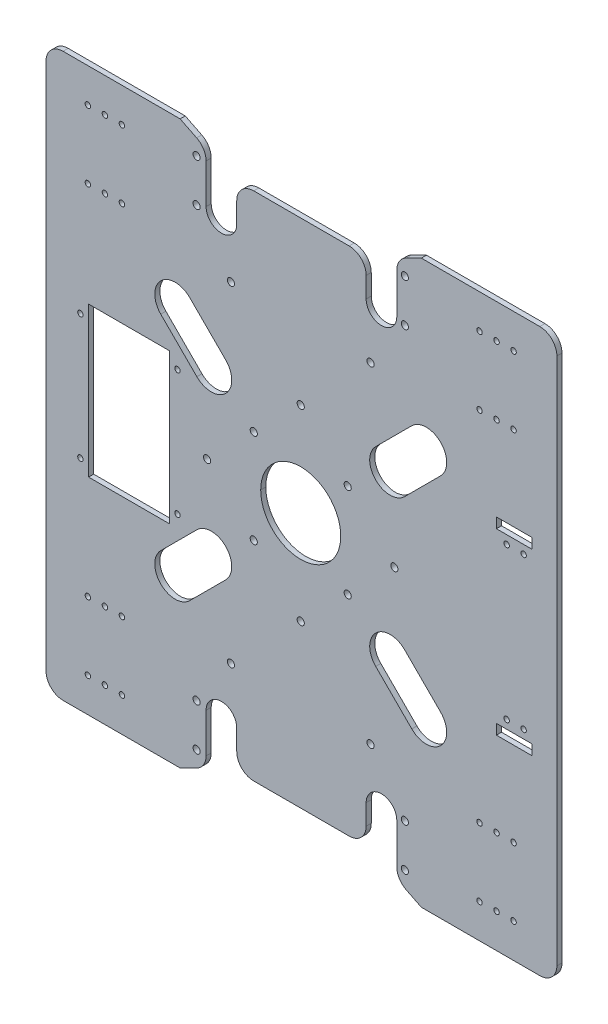
from build123d import *

# Parameters (mm, degrees)
SKETCH_1_R           = 2.100000001
SKETCH_1_R_2         = 2.1
EXTRUDE_1_DEPTH      = 3
CUT_EXTRUDE_1_DEPTH  = 3
SKETCH_8_R           = 2.1
CUT_EXTRUDE_4_DEPTH  = 10
CUT_EXTRUDE_6_DEPTH  = 73
SKETCH_11_R          = 2.1
CUT_EXTRUDE_7_DEPTH  = 73
SKETCH_12_R          = 1.6
CUT_EXTRUDE_8_DEPTH  = 494.526807752
SKETCH_15_W          = 21
SKETCH_15_H          = 6
CUT_EXTRUDE_11_DEPTH = 494.526807752
EXTRUDE_START        = -3
SKETCH_16_R          = 2.1
EXTRUDE_2_DEPTH      = 3
SKETCH_17_R          = 1.6
CUT_EXTRUDE_12_DEPTH = 10
SKETCH_18_W          = 47.4
SKETCH_18_H          = 88
CUT_EXTRUDE_13_DEPTH = 10
SKETCH_19_R          = 1.6
CUT_EXTRUDE_14_DEPTH = 10
CUT_EXTRUDE_START    = -3
SKETCH_20_R          = 1.6
CUT_EXTRUDE_15_DEPTH = 3
CUT_EXTRUDE_START_2  = -10
SKETCH_21_R          = 1.6
CUT_EXTRUDE_16_DEPTH = 10
FILLET_1_R           = 10
FILLET_2_R           = 10
FILLET_3_R           = 10
FILLET_4_R           = 10
FILLET_START         = -1
FILLET_5_DEPTH       = 5
FILLET_6_R           = 10


with BuildPart() as part:
    # 草图1 → 凸台-拉伸1 (new body)
    with BuildSketch(Plane.XY):
        with BuildLine():
            Line((439.415186233, 59.591100047), (407.692037148, 59.591100047))
            Line((407.692037148, 59.591100047), (360.292037148, 59.591100047))
            Line((360.292037148, 59.591100047), (312.491923445, 59.591100047))
            ThreePointArc((312.491923445, 59.591100047), (288.992037148, 83.16420293), (265.492150851, 59.591100047))
            Line((265.492150851, 59.591100047), (139.415186233, 59.591100047))
            Line((139.415186233, 59.591100047), (139.415186233, 101.66420293))
            Line((139.415186233, 101.66420293), (139.415186233, 128.16420293))
            Line((139.415186233, 128.16420293), (139.415186233, 214.66420293))
            ThreePointArc((139.415186233, 214.66420293), (142.344118421, 221.735270742), (149.415186233, 224.66420293))
            Line((149.415186233, 224.66420293), (227.415186233, 224.66420293))
            ThreePointArc((227.415186233, 224.66420293), (231.65782692, 222.906843617), (233.415186233, 218.66420293))
            Line((233.415186233, 218.66420293), (233.415186233, 189.66420293))
            Line((233.415186233, 189.66420293), (233.415186233, 187.66420293))
            ThreePointArc((233.415186233, 187.66420293), (242.415186233, 178.66420293), (251.415186233, 187.66420293))
            Line((251.415186233, 187.66420293), (251.415186233, 189.66420293))
            Line((251.415186233, 189.66420293), (251.415186233, 199.66420293))
            ThreePointArc((251.415186233, 199.66420293), (254.344118421, 206.735270742), (261.415186233, 209.66420293))
            Line((261.415186233, 209.66420293), (317.415186233, 209.66420293))
            ThreePointArc((317.415186233, 209.66420293), (324.486254044, 206.735270742), (327.415186233, 199.66420293))
            Line((327.415186233, 199.66420293), (327.415186233, 189.66420293))
            Line((327.415186233, 189.66420293), (327.415186233, 187.66420293))
            ThreePointArc((327.415186233, 187.66420293), (336.415186233, 178.66420293), (345.415186233, 187.66420293))
            Line((345.415186233, 187.66420293), (345.415186233, 189.66420293))
            Line((345.415186233, 189.66420293), (345.415186233, 218.66420293))
            ThreePointArc((345.415186233, 218.66420293), (347.172545545, 222.906843617), (351.415186233, 224.66420293))
            Line((351.415186233, 224.66420293), (429.415186233, 224.66420293))
            ThreePointArc((429.415186233, 224.66420293), (436.486254044, 221.735270742), (439.415186233, 214.66420293))
            Line((439.415186233, 214.66420293), (439.415186233, 115.961294267))
            Line((439.415186233, 115.961294267), (439.415186233, 108.66420293))
            Line((439.415186233, 108.66420293), (439.415186233, 59.591100047))
        make_face()
        with Locations((329.992037148, 156.591100047)):
            Circle(SKETCH_1_R, mode=Mode.SUBTRACT)
        with Locations(Location((247.992037148, 156.591100047, 0), (0, 0, 180))):
            Circle(SKETCH_1_R, mode=Mode.SUBTRACT)
        with Locations((409.415186233, 104.591100047)):
            Circle(SKETCH_1_R_2, mode=Mode.SUBTRACT)
        with Locations((419.415186233, 104.591100047)):
            Circle(SKETCH_1_R_2, mode=Mode.SUBTRACT)
    extrude_1 = extrude(amount=EXTRUDE_1_DEPTH)

    # 草图2 → 切除-拉伸1 (cut)
    with BuildSketch(Plane.XY.offset(3)):
        Polygon((345.415186233, 217.51420293), (338.317591395, 217.51420293), (359.815186233, 234.932605723), (359.815186233, 224.66420293), align=None)
        Polygon((232.568888064, 217.51420293), (218.168888064, 224.66420293), (218.168888064, 234.932605723), (239.666482901, 217.51420293), align=None)
    cut_extrude_1 = extrude(amount=-CUT_EXTRUDE_1_DEPTH, mode=Mode.SUBTRACT)

    # 镜向2: 凸台-拉伸1, 切除-拉伸1 across plane
    add(extrude_1.mirror(Plane(origin=(265.492150851, 59.591100047, 3), x_dir=(0, 0, 1), z_dir=(0, 1, 0))))
    add(cut_extrude_1.mirror(Plane(origin=(265.492150851, 59.591100047, 3), x_dir=(0, 0, 1), z_dir=(0, 1, 0))), mode=Mode.SUBTRACT)

    # 草图8 → 切除-拉伸4 (cut)
    with BuildSketch(Plane(origin=(0, 0, 0), x_dir=(-1, 0, 0), z_dir=(0, 0, -1))):
        with Locations((-343.992037148, 59.517997165)):
            Circle(SKETCH_8_R)
        with Locations((-316.569201614, 31.940832699)):
            Circle(SKETCH_8_R)
        with Locations((-288.992037148, 4.517997165)):
            Circle(SKETCH_8_R)
        with Locations((-261.414872682, 31.940832699)):
            Circle(SKETCH_8_R)
        with Locations((-233.992037148, 59.517997165)):
            Circle(SKETCH_8_R)
        with Locations((-316.569201614, 87.095161631)):
            Circle(SKETCH_8_R)
        with Locations((-288.992037148, 114.517997165)):
            Circle(SKETCH_8_R)
        with Locations((-261.414872682, 87.095161631)):
            Circle(SKETCH_8_R)
    extrude(amount=-CUT_EXTRUDE_4_DEPTH, mode=Mode.SUBTRACT)

    # 草图10 → 切除-拉伸6 (cut)
    with BuildSketch(Plane(origin=(0, 0, 0), x_dir=(-1, 0, 0), z_dir=(0, 0, -1))):
        with BuildLine():
            Line((-349.991019613, 20.590082512), (-371.188399044, -0.607296919))
            ThreePointArc((-371.188399044, -0.607296919), (-371.188399044, -17.577859668), (-354.217836295, -17.577859668))
            Line((-354.217836295, -17.577859668), (-333.020456864, 3.619519763))
            ThreePointArc((-333.020456864, 3.619519763), (-333.020456864, 20.590082512), (-349.991019613, 20.590082512))
        make_face()
        with BuildLine():
            Line((-333.020456864, 115.416474566), (-354.217836295, 136.613853997))
            ThreePointArc((-354.217836295, 136.613853997), (-371.188399044, 136.613853997), (-371.188399044, 119.643291249))
            Line((-371.188399044, 119.643291249), (-349.991019613, 98.445911818))
            ThreePointArc((-349.991019613, 98.445911818), (-333.020456864, 98.445911818), (-333.020456864, 115.416474566))
        make_face()
        with BuildLine():
            Line((-227.993054684, 98.445911818), (-206.795675252, 119.643291249))
            ThreePointArc((-206.795675252, 119.643291249), (-206.795675252, 136.613853997), (-223.766238001, 136.613853997))
            Line((-223.766238001, 136.613853997), (-244.963617432, 115.416474566))
            ThreePointArc((-244.963617432, 115.416474566), (-244.963617432, 98.445911818), (-227.993054684, 98.445911818))
        make_face()
        with BuildLine():
            Line((-244.963617432, 3.619519763), (-223.766238001, -17.577859668))
            ThreePointArc((-223.766238001, -17.577859668), (-206.795675252, -17.577859668), (-206.795675252, -0.607296919))
            Line((-206.795675252, -0.607296919), (-227.993054684, 20.590082512))
            ThreePointArc((-227.993054684, 20.590082512), (-244.963617432, 20.590082512), (-244.963617432, 3.619519763))
        make_face()
    extrude(amount=-CUT_EXTRUDE_6_DEPTH, mode=Mode.SUBTRACT)

    # 草图11 → 切除-拉伸7 (cut)
    with BuildSketch(Plane(origin=(0, 0, 0), x_dir=(-1, 0, 0), z_dir=(0, 0, -1))):
        with Locations((-227.845186233, 185.66420293)):
            Circle(SKETCH_11_R)
        with Locations((-227.845186233, 210.66420293)):
            Circle(SKETCH_11_R)
        with Locations((-227.845186233, -91.33579707)):
            Circle(SKETCH_11_R)
        with Locations((-227.845186233, -66.33579707)):
            Circle(SKETCH_11_R)
        with Locations((-350.138888064, -66.33579707)):
            Circle(SKETCH_11_R)
        with Locations((-350.138888064, -91.33579707)):
            Circle(SKETCH_11_R)
        with Locations((-350.138888064, 210.66420293)):
            Circle(SKETCH_11_R)
        with Locations((-350.138888064, 185.66420293)):
            Circle(SKETCH_11_R)
    extrude(amount=-CUT_EXTRUDE_7_DEPTH, mode=Mode.SUBTRACT)

    # 草图12 → 切除-拉伸8 (cut, through all)
    with BuildSketch(Plane(origin=(0, 0, 0), x_dir=(-1, 0, 0), z_dir=(0, 0, -1))):
        with Locations((-413.995186233, 204.591100047)):
            Circle(SKETCH_12_R)
        with Locations((-406.596402043, 244.409537894)):
            Circle(SKETCH_12_R)
        with Locations((-403.995186233, 204.591100047)):
            Circle(SKETCH_12_R)
        with Locations((-396.596402043, 244.409537894)):
            Circle(SKETCH_12_R)
        with Locations((-393.995186233, 204.591100047)):
            Circle(SKETCH_12_R)
        with Locations((-386.596402043, 244.409537894)):
            Circle(SKETCH_12_R)
        with Locations((-386.596402043, -125.227337799)):
            Circle(SKETCH_12_R)
        with Locations(Location((-393.995186233, -85.408899953, 0), (0, 0, 180))):
            Circle(SKETCH_12_R)
        with Locations((-396.596402043, -125.227337799)):
            Circle(SKETCH_12_R)
        with Locations(Location((-403.995186233, -85.408899953, 0), (0, 0, 180))):
            Circle(SKETCH_12_R)
        with Locations((-406.596402043, -125.227337799)):
            Circle(SKETCH_12_R)
        with Locations(Location((-413.995186233, -85.408899953, 0), (0, 0, 180))):
            Circle(SKETCH_12_R)
        with Locations((-163.988888064, -85.408899953)):
            Circle(SKETCH_12_R)
        with Locations((-171.387672253, -125.227337799)):
            Circle(SKETCH_12_R)
        with Locations((-173.988888064, -85.408899953)):
            Circle(SKETCH_12_R)
        with Locations((-181.387672253, -125.227337799)):
            Circle(SKETCH_12_R)
        with Locations((-183.988888064, -85.408899953)):
            Circle(SKETCH_12_R)
        with Locations((-191.387672253, -125.227337799)):
            Circle(SKETCH_12_R)
        with Locations((-191.387672253, 244.409537894)):
            Circle(SKETCH_12_R)
        with Locations(Location((-183.988888064, 204.591100047, 0), (0, 0, 180))):
            Circle(SKETCH_12_R)
        with Locations((-181.387672253, 244.409537894)):
            Circle(SKETCH_12_R)
        with Locations(Location((-173.988888064, 204.591100047, 0), (0, 0, 180))):
            Circle(SKETCH_12_R)
        with Locations((-171.387672253, 244.409537894)):
            Circle(SKETCH_12_R)
        with Locations(Location((-163.988888064, 204.591100047, 0), (0, 0, 180))):
            Circle(SKETCH_12_R)
    extrude(amount=-CUT_EXTRUDE_8_DEPTH, mode=Mode.SUBTRACT)

    # 草图15 → 切除-拉伸11 (cut, through all)
    with BuildSketch(Plane.XY.offset(3)):
        with Locations((414.415186233, 112.091100047)):
            Rectangle(SKETCH_15_W, SKETCH_15_H)
        with Locations((414.415186233, 7.091100047)):
            Rectangle(SKETCH_15_W, SKETCH_15_H)
    extrude(amount=-CUT_EXTRUDE_11_DEPTH, mode=Mode.SUBTRACT)

    # 草图16 → 凸台-拉伸2 (add)
    with BuildSketch(Plane.XY.offset(3).offset(EXTRUDE_START)):
        with Locations((409.415186233, 104.591100047)):
            Circle(SKETCH_16_R)
        with Locations((419.415186233, 104.591100047)):
            Circle(SKETCH_16_R)
        with Locations((419.415186233, 14.591100047)):
            Circle(SKETCH_16_R)
        with Locations((409.415186233, 14.591100047)):
            Circle(SKETCH_16_R)
    extrude(amount=EXTRUDE_2_DEPTH)

    # 草图17 → 切除-拉伸12 (cut)
    with BuildSketch(Plane.XY.offset(3)):
        with Locations((409.915186233, 15.091100047)):
            Circle(SKETCH_17_R)
        with Locations((419.915186233, 15.091100047)):
            Circle(SKETCH_17_R)
        with Locations((409.915186233, 104.091100047)):
            Circle(SKETCH_17_R)
        with Locations((419.915186233, 104.091100047)):
            Circle(SKETCH_17_R)
    extrude(amount=-CUT_EXTRUDE_12_DEPTH, mode=Mode.SUBTRACT)

    # 草图18 → 切除-拉伸13 (cut)
    with BuildSketch(Plane.XY.offset(3)):
        with Locations((188.115186233, 59.591100047)):
            Rectangle(SKETCH_18_W, SKETCH_18_H)
    extrude(amount=-CUT_EXTRUDE_13_DEPTH, mode=Mode.SUBTRACT)

    # 草图19 → 切除-拉伸14 (cut)
    with BuildSketch(Plane.XY.offset(3)):
        with Locations((159.615186233, 22.841100047)):
            Circle(SKETCH_19_R)
        with Locations((216.615186233, 22.841100047)):
            Circle(SKETCH_19_R)
        with Locations((216.615186233, 96.341100047)):
            Circle(SKETCH_19_R)
        with Locations((159.615186233, 96.341100047)):
            Circle(SKETCH_19_R)
    extrude(amount=-CUT_EXTRUDE_14_DEPTH, mode=Mode.SUBTRACT)

    # 草图20 → 切除-拉伸15 (cut)
    with BuildSketch(Plane.XY.offset(3).offset(CUT_EXTRUDE_START)):
        with Locations((163.988888064, 204.591100047)):
            Circle(SKETCH_20_R)
        with Locations((173.988888064, 204.591100047)):
            Circle(SKETCH_20_R)
        with Locations((183.988888064, 204.591100047)):
            Circle(SKETCH_20_R)
        with Locations(Location((413.995186233, 204.591100047, 0), (0, 0, 180))):
            Circle(SKETCH_20_R)
        with Locations(Location((403.995186233, 204.591100047, 0), (0, 0, 180))):
            Circle(SKETCH_20_R)
        with Locations(Location((393.995186233, 204.591100047, 0), (0, 0, 180))):
            Circle(SKETCH_20_R)
        with Locations((413.995186233, 164.591100047)):
            Circle(SKETCH_20_R)
        with Locations((403.995186233, 164.591100047)):
            Circle(SKETCH_20_R)
        with Locations((393.995186233, 164.591100047)):
            Circle(SKETCH_20_R)
        with Locations((163.988888064, 164.591100047)):
            Circle(SKETCH_20_R)
        with Locations((173.988888064, 164.591100047)):
            Circle(SKETCH_20_R)
        with Locations((183.988888064, 164.591100047)):
            Circle(SKETCH_20_R)
    extrude(amount=CUT_EXTRUDE_15_DEPTH, mode=Mode.SUBTRACT)

    # 草图21 → 切除-拉伸16 (cut)
    with BuildSketch(Plane.XY.offset(3).offset(CUT_EXTRUDE_START_2)):
        with Locations((413.995186233, -85.408899953)):
            Circle(SKETCH_21_R)
        with Locations((403.995186233, -85.408899953)):
            Circle(SKETCH_21_R)
        with Locations((393.995186233, -85.408899953)):
            Circle(SKETCH_21_R)
        with Locations(Location((173.988888064, -85.408899953, 0), (0, 0, 180))):
            Circle(SKETCH_21_R)
        with Locations(Location((183.988888064, -85.408899953, 0), (0, 0, 180))):
            Circle(SKETCH_21_R)
        with Locations(Location((163.988888064, -85.408899953, 0), (0, 0, 180))):
            Circle(SKETCH_21_R)
        with Locations(Location((413.995186233, -45.408899953, 0), (0, 0, 180))):
            Circle(SKETCH_21_R)
        with Locations(Location((403.995186233, -45.408899953, 0), (0, 0, 180))):
            Circle(SKETCH_21_R)
        with Locations(Location((393.995186233, -45.408899953, 0), (0, 0, 180))):
            Circle(SKETCH_21_R)
        with Locations(Location((183.988888064, -45.408899953, 0), (0, 0, 180))):
            Circle(SKETCH_21_R)
        with Locations(Location((173.988888064, -45.408899953, 0), (0, 0, 180))):
            Circle(SKETCH_21_R)
        with Locations(Location((163.988888064, -45.408899953, 0), (0, 0, 180))):
            Circle(SKETCH_21_R)
    extrude(amount=CUT_EXTRUDE_16_DEPTH, mode=Mode.SUBTRACT)

    # 圆角1
    # the kernel refuses this fillet: 10 mm, written as the material it takes off along each edge
    with BuildSketch(Plane(origin=(233.415186233, 217.51420293, -10.065331211), x_dir=(0, -1, 0), z_dir=(0, 0, 1))) as fillet_1_piece_1:
        with BuildLine():
            CenterArc((4.026132484, -10), FILLET_1_R, 90, 23.741647232)
            Line((0, -0.846298169), (-0.08052265, -0.663224132))
            ThreePointArc((-0.08052265, -0.663224132), (-0.2, -0.423149084), (-0.2, 0))
            Line((-0.2, 0), (0, 0.2))
            Line((0, 0.2), (4.026132484, 0.2))
            Line((4.026132484, 0.2), (4.026132484, 0))
        make_face()
    extrude(amount=23.130662422, mode=Mode.SUBTRACT)

    # 圆角2
    # the kernel refuses this fillet: 10 mm, written as the material it takes off along each edge
    with BuildSketch(Plane(origin=(232.568888064, 217.51420293, 19.684163243), x_dir=(0.12681159916662038, -0.9919268210492165, 0), z_dir=(0, 0, -1))) as fillet_2_piece_1:
        with BuildLine():
            CenterArc((5.405549305, 9.91926821), FILLET_2_R, 213.691060694, 63.594324711)
            Line((-2.914857485, 4.372122021), (-3.746898164, 3.817407402))
            Line((-3.746898164, 3.817407402), (-0.832040679, -0.554714619))
            Line((-0.832040679, -0.554714619), (-0.283283323, -0.959036266))
            ThreePointArc((-0.283283323, -0.959036266), (4.22776082, -1.320832374), (6.800476896, -0.991926821))
            Line((6.800476896, -0.991926821), (6.673665297, 0))
        make_face()
    extrude(amount=36.368326485, mode=Mode.SUBTRACT)

    # 圆角3
    fillet_3_edges = [part.edges().sort_by_distance(p)[0] for p in [
        (345.415186233, 217.51420293, 1.5),
    ]]
    fillet(fillet_3_edges, radius=FILLET_3_R)

    # 圆角4
    # the kernel refuses this fillet: 10 mm, written as the material it takes off along each edge
    with BuildSketch(Plane(origin=(233.415186233, -98.332002835, 13.065331211), x_dir=(0, 1, 0), z_dir=(0, 0, -1))) as fillet_4_piece_1:
        with BuildLine():
            CenterArc((4.026132484, -10), FILLET_4_R, 90, 23.741647232)
            Line((0, -0.846298169), (0, 0))
            Line((0, 0), (4.026132484, 0))
        make_face()
    extrude(amount=23.130662422, mode=Mode.SUBTRACT)

    # 圆角5: read off the stored shape, not the designer's step
    # 圆角5 outline → 圆角5 (cut)
    with BuildSketch(Plane.XY.offset(FILLET_START)):
        with BuildLine():
            ThreePointArc((233.415186233, -91.712215232), (231.914374133, -96.981352261), (227.862425227, -100.668892369))
            Line((227.862425227, -100.668892369), (232.568888064, -98.332002835))
            ThreePointArc((232.568888064, -98.332002835), (233.201324856, -96.362929135), (233.415186233, -94.305870351))
            Line((233.415186233, -94.305870351), (233.415186233, -91.712215232))
        make_face()
    extrude(amount=FILLET_5_DEPTH, mode=Mode.SUBTRACT)

    # 圆角6
    fillet_6_edges = [part.edges().sort_by_distance(p)[0] for p in [
        (345.415186233, -98.332002835, 1.5),
    ]]
    fillet(fillet_6_edges, radius=FILLET_6_R)


solid = part.part
